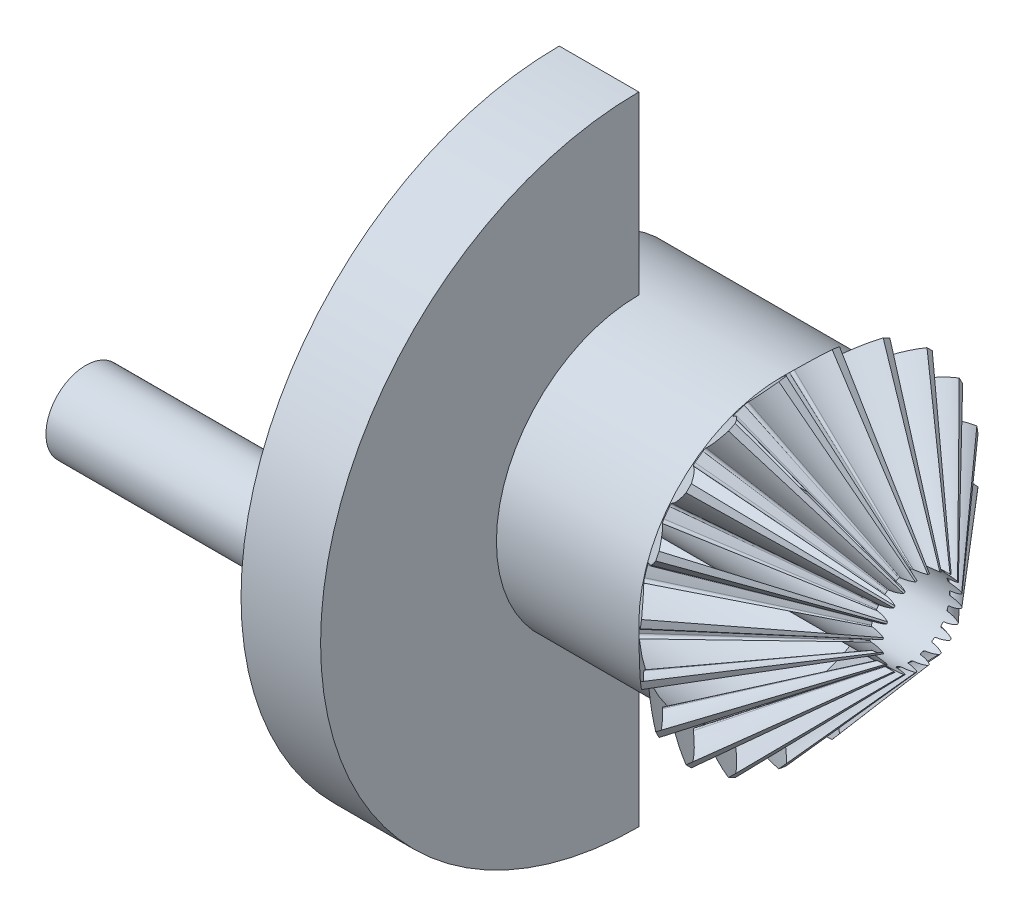
from build123d import *

# Parameters (mm, degrees)
TEETHCUTS_COUNT     = 20
TEETHCUTS_ANGLE     = 342
HUBSKE_R            = 8.949062546
HUB_DEPTH           = 13.949164146
BORSKE_R            = 2.5
BORE_DEPTH          = 25.0000508
BOSS_EXTRUDE1_START = -5
BOSS_EXTRUDE1_DEPTH = 5
BOSS_EXTRUDE2_DEPTH = 20


with BuildPart() as part:
    # BasProSke → Base-Revolve (revolve)
    with BuildSketch(Plane(origin=(0, 0, 0), x_dir=(1, 0, 0), z_dir=(0, 1, 0)), mode=Mode.PRIVATE) as base_revolve_sk:
        Polygon((0, 0), (0, 8.949062547), (1.758044236, 10.707106781), (10.121648124, 1.070710669), (9.945843702, 0.894906248), (9.945843702, 0), align=None)
    revolve(base_revolve_sk.sketch.rotate(Axis((-10, 0, 0), (1, 0, 0)), 180), axis=Axis((-10, 0, 0), (1, 0, 0)))

    # ToothCut: read off the stored shape, not the designer's step
    # ToothCut: loft between two sections, ruled curve by curve
    toothcut_from = [
        Edge.make_bspline([(11.056978059, 0.006040604, -0.009397446), (11.052757644, 0.001820189, -0.014823153), (11.047082221, -0.003855234, -0.014022361), (11.043703013, -0.007234441, -0.007524359)], [0, 0, 0, 0, 1, 1, 1, 1], 3, [1, 0.779680287, 0.779680287, 1]),
        Edge.make_bspline([(11.043703013, -0.007234441, 0.007524359), (11.047082221, -0.003855234, 0.014022361), (11.052757644, 0.001820189, 0.014823153), (11.056978059, 0.006040604, 0.009397446)], [0, 0, 0, 0, 1, 1, 1, 1], 3, [1, 0.779680287, 0.779680287, 1]),
        Edge.make_bspline([(11.043703013, -0.007234441, -0.007524359), (11.043200956, -0.007736499, -0.006558934), (11.042799872, -0.008137583, -0.005503268), (11.04250773, -0.008429724, -0.004378334)], [0, 0, 0, 0, 1, 1, 1, 1], 3, [1, 0.993377071, 0.993377071, 1]),
        Edge.make_bspline([(11.04250773, -0.008429724, 0.004378334), (11.042799872, -0.008137583, 0.005503268), (11.043200956, -0.007736499, 0.006558934), (11.043703013, -0.007234441, 0.007524359)], [0, 0, 0, 0, 1, 1, 1, 1], 3, [1, 0.993377071, 0.993377071, 1]),
        Edge.make_bspline([(11.04250773, -0.008429724, -0.004378334), (11.041765856, -0.009171599, -0.001521635), (11.041765856, -0.009171599, 0.001521635), (11.04250773, -0.008429724, 0.004378334)], [0, 0, 0, 0, 1, 1, 1, 1], 3, [1, 0.959129516, 0.959129516, 1]),
        Edge.make_line((11.056978059, 0.006040604, 0.009397446), (11.056978059, 0.006040604, -0.009397446)),
    ]
    toothcut_to = [
        Edge.make_bspline([(1.831702175, 10.780764719, -1.608058394), (1.416177176, 10.365239721, -1.022568098), (0.895186141, 9.844248687, -0.641441323), (0.317192874, 9.266255421, -0.500131372)], [0, 0, 0, 0, 1, 1, 1, 1], 3, [1, 0.968992554, 0.968992554, 1]),
        Edge.make_bspline([(0.317192874, 9.266255421, 0.500131372), (0.895186141, 9.844248687, 0.641441323), (1.416177176, 10.365239721, 1.022568098), (1.831702175, 10.780764719, 1.608058394)], [0, 0, 0, 0, 1, 1, 1, 1], 3, [1, 0.968992554, 0.968992554, 1]),
        Edge.make_bspline([(0.317192874, 9.266255421, -0.500131372), (0.248143517, 9.197206064, -0.483249928), (0.20395306, 9.153015607, -0.406340777), (0.206397022, 9.155459569, -0.307302074)], [0, 0, 0, 0, 1, 1, 1, 1], 3, [1, 0.835744927, 0.835744927, 1]),
        Edge.make_bspline([(0.206397022, 9.155459569, 0.307302074), (0.20395306, 9.153015607, 0.406340777), (0.248143517, 9.197206064, 0.483249928), (0.317192874, 9.266255421, 0.500131372)], [0, 0, 0, 0, 1, 1, 1, 1], 3, [1, 0.835744927, 0.835744927, 1]),
        Edge.make_bspline([(0.206397022, 9.155459569, -0.307302074), (0.211451493, 9.16051404, -0.102475588), (0.211451493, 9.16051404, 0.102475588), (0.206397022, 9.155459569, 0.307302074)], [0, 0, 0, 0, 1, 1, 1, 1], 3, [1, 0.999594406, 0.999594406, 1]),
        Edge.make_line((1.831702175, 10.780764719, 1.608058394), (1.831702175, 10.780764719, -1.608058394)),
    ]
    toothcut = Solid(Shell([*[Face.make_surface_from_curves(toothcut_from[k], toothcut_to[k]) for k in range(6)], Face(Wire(toothcut_from)), Face(Wire(toothcut_to))]))
    add(toothcut, mode=Mode.SUBTRACT)

    # TeethCuts: ToothCut ×20 about axis
    teethcuts_axis = Axis((-10, 0, 0), (1, 0, 0))
    for i in range(1, TEETHCUTS_COUNT):
        add(toothcut.rotate(teethcuts_axis, i * TEETHCUTS_ANGLE / (TEETHCUTS_COUNT - 1)), mode=Mode.SUBTRACT)

    # HubSke → Hub (add)
    with BuildSketch(Plane.ZY):
        Circle(HUBSKE_R)
    extrude(amount=HUB_DEPTH)

    # BorSke → Bore (cut, symmetric)
    with BuildSketch(Plane(origin=(0, 0, 0), x_dir=(0, 0, -1), z_dir=(1, 0, 0))):
        with Locations(Location((0, 0, 0), (0, 0, 180))):
            Circle(BORSKE_R)
    extrude(amount=BORE_DEPTH, both=True, mode=Mode.SUBTRACT)

    # Sketch1 → Boss-Extrude1 (add)
    with BuildSketch(Plane.ZY.offset(13.949164146).offset(BOSS_EXTRUDE1_START)):
        with BuildLine():
            Line((0, 20), (0, 2.5))
            ThreePointArc((0, 2.5), (2.5, 0), (0, -2.5))
            Line((0, -2.5), (0, -20))
            ThreePointArc((0, -20), (20, 0), (0, 20))
        make_face()
    extrude(amount=BOSS_EXTRUDE1_DEPTH)

    # Sketch2 → Boss-Extrude2 (add)
    with BuildSketch(Plane(origin=(-8.949164146, 0, 0), x_dir=(0, 0, -1), z_dir=(1, 0, 0))):
        with BuildLine():
            ThreePointArc((-17.261196716, 0), (-14.761196716, -2.5), (-12.261196716, 0))
            Line((-12.261196716, 0), (-17.261196716, 0))
        make_face()
        with BuildLine():
            Line((-17.261196716, 0), (-12.261196716, 0))
            ThreePointArc((-12.261196716, 0), (-14.761196716, 2.5), (-17.261196716, 0))
        make_face()
    extrude(amount=-BOSS_EXTRUDE2_DEPTH)


solid = part.part
